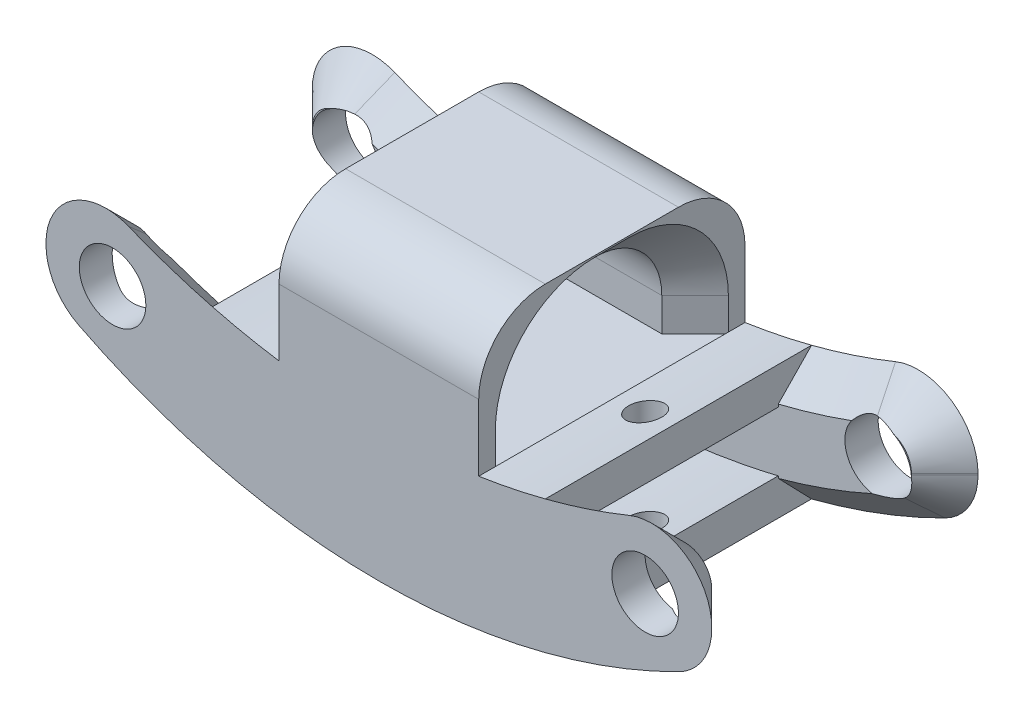
from build123d import *

# Parameters (mm, degrees)
SKETCH2_W               = 50
SKETCH2_H               = 10
BOSS_EXTRUDE2_DEPTH     = 10
CUT_EXTRUDE1_DEPTH      = 30
BOSS_EXTRUDE3_DEPTH     = 20
CUT_SWEEP1_START        = -7.5
CUT_SWEEP1_DEPTH        = 15
CUT_EXTRUDE3_DEPTH      = 30.35745708
CUT_EXTRUDE3_DEPTH_BACK = 30.35745708
SKETCH9_W               = 12.5
SKETCH9_H               = 15
CUT_EXTRUDE4_DEPTH      = 35.086071704
CUT_EXTRUDE4_DEPTH_BACK = 35.086071704
SKETCH10_R              = 2.5
FILLET1_R               = 4.5
BOSS_EXTRUDE4_DEPTH     = 20
SKETCH12_W              = 15
SKETCH12_H              = 20
BOSS_EXTRUDE5_DEPTH     = 10
SKETCH13_W              = 12.5
SKETCH13_H              = 7.5
CUT_EXTRUDE5_DEPTH      = 15
FILLET2_R               = 5
CHAMFER4_SIZE           = 2.5
CHAMFER5_SIZE           = 2.5
SKETCH14_R              = 1.25
CUT_EXTRUDE6_DEPTH      = 30.35745708


# Read off the part's stored shape, not the designer's step: Cut-Sweep1
with BuildPart() as part:
    # Sketch2 → Boss-Extrude2 (new, symmetric)
    with BuildSketch(Plane.XY):
        Rectangle(SKETCH2_W, SKETCH2_H)
    extrude(amount=BOSS_EXTRUDE2_DEPTH, both=True)

    # Sketch4 → Cut-Extrude1 (cut)
    with BuildSketch(Plane.XY.offset(10)):
        with BuildLine():
            ThreePointArc((-25, 5), (0, -1.698729811), (25, 5))
            Line((25, 5), (-25, 5))
        make_face()
        with BuildLine():
            ThreePointArc((-20.917760076, 2.887094942), (-22.701682649, 4.440465894), (-25, 5))
            ThreePointArc((-25, 5), (-22.983173509, 3.896611251), (-20.917760076, 2.887094942))
        make_face()
        with BuildLine():
            ThreePointArc((20.917760076, 2.887094942), (22.983173509, 3.896611251), (25, 5))
            ThreePointArc((25, 5), (22.701682649, 4.440465894), (20.917760076, 2.887094942))
        make_face()
    extrude(amount=-CUT_EXTRUDE1_DEPTH, mode=Mode.SUBTRACT)

    # Sketch5 → Boss-Extrude3 (add)
    with BuildSketch(Plane.XY.offset(10)):
        with BuildLine():
            Line((-25, -5), (25, -5))
            ThreePointArc((25, -5), (0, -11.698729811), (-25, -5))
        make_face()
    extrude(amount=-BOSS_EXTRUDE3_DEPTH)

    # Cut-Sweep1 outline → Cut-Sweep1 (cut)
    with BuildSketch(Plane.XY.offset(CUT_SWEEP1_START)):
        with BuildLine():
            add(Edge.make_bspline(
                [(-25, 2.5), (-21.255268345, 0.201017062), (-17.071138999, -1.630822115), (-8.283244372, -4.049516959), (-3.658771416, -4.626672198), (5.489489761, -4.455807498), (10.02627077, -3.697584153), (16.396780129, -1.708708768), (18.457451053, -0.894221408), (21.996641603, 0.764864463), (23.51747082, 1.610795597), (25, 2.511750463)],
                knots=[0.022827862, 0.022827862, 0.022827862, 0.022827862, 0.267120896, 0.267120896, 0.511413931, 0.511413931, 0.755706965, 0.755706965, 0.877853483, 0.877853483, 0.97657148, 0.97657148, 0.97657148, 0.97657148], degree=3))
            Line((-25, 2.5), (-25.000057187, -2.499968839))
            add(Edge.make_bspline(
                [(-25.000057187, -2.499968839), (-25.000038125, -2.499979226), (-25.000019062, -2.499989613), (-20.780823633, -4.798983078), (-16.147021573, -6.56849847), (-6.428489716, -8.717977703), (-1.37520543, -9.101253459), (8.592599128, -8.406410428), (13.482086252, -7.341506001), (20.316419226, -4.821848118), (22.503670345, -3.841925841), (24.731352369, -2.645524362), (24.865952164, -2.572392372), (25.000024678, -2.498748447)],
                knots=[0.022826758, 0.022826758, 0.022826758, 0.022826758, 0.022827862, 0.022827862, 0.267120896, 0.267120896, 0.511413931, 0.511413931, 0.755706965, 0.755706965, 0.877853483, 0.877853483, 0.885741168, 0.885741168, 0.885741168, 0.885741168], degree=3))
            Line((25.000024678, -2.498748447), (25, 2.511750463))
        make_face()
    extrude(amount=CUT_SWEEP1_DEPTH, mode=Mode.SUBTRACT)

    # Sketch9 → Cut-Extrude3 (cut, two sides: drawn at the far end of the back side and taken through both)
    with BuildSketch(Plane(origin=(0, 0, 0), x_dir=(1, 0, 0), z_dir=(0, 1, 0)).offset(-CUT_EXTRUDE3_DEPTH_BACK)):
        with Locations((18.75, 0)):
            Rectangle(SKETCH9_W, SKETCH9_H)
        with Locations((-18.75, 0)):
            Rectangle(SKETCH9_W, SKETCH9_H)
    extrude(amount=CUT_EXTRUDE3_DEPTH + CUT_EXTRUDE3_DEPTH_BACK, mode=Mode.SUBTRACT)

    # Sketch10 → Cut-Extrude4 (cut, two sides: drawn at the far end of the back side and taken through both)
    with BuildSketch(Plane.XY.offset(10).offset(-CUT_EXTRUDE4_DEPTH_BACK)):
        with Locations((-20, -2.52448676)):
            Circle(SKETCH10_R)
        with Locations(Location((20, -2.52448676, 0), (0, 0, 90))):
            Circle(SKETCH10_R)
    extrude(amount=CUT_EXTRUDE4_DEPTH + CUT_EXTRUDE4_DEPTH_BACK, mode=Mode.SUBTRACT)

    # Fillet1
    fillet1_edges = [part.edges().sort_by_distance(p)[0] for p in [
        (25, -5, -8.75),
        (25, 5, -8.75),
        (25, -5, 8.75),
        (25, 5, 8.75),
        (-25, -5, 8.75),
        (-25, 5, 8.75),
        (-25, -5, -8.75),
        (-25, 5, -8.75),
    ]]
    fillet(fillet1_edges, radius=FILLET1_R)

    # Sketch11 → Boss-Extrude4 (add)
    with BuildSketch(Plane.XY.offset(10)):
        with BuildLine():
            Line((-7.5, -1.133029644), (7.5, -1.133029644))
            ThreePointArc((7.5, -1.133029644), (0, -1.698729811), (-7.5, -1.133029644))
        make_face()
    extrude(amount=-BOSS_EXTRUDE4_DEPTH)

    # Sketch12 → Boss-Extrude5 (add)
    with BuildSketch(Plane(origin=(0, -1.133029644, 0), x_dir=(1, 0, 0), z_dir=(0, 1, 0))):
        Rectangle(SKETCH12_W, SKETCH12_H)
    extrude(amount=BOSS_EXTRUDE5_DEPTH)

    # Sketch13 → Cut-Extrude5 (cut)
    with BuildSketch(Plane.ZY.offset(7.5)):
        with Locations((0, 2.5)):
            Rectangle(SKETCH13_W, SKETCH13_H)
    extrude(amount=-CUT_EXTRUDE5_DEPTH, mode=Mode.SUBTRACT)

    # Fillet2
    fillet2_edges = [part.edges().sort_by_distance(p)[0] for p in [
        (0, 8.866970356, -10),
        (0, 8.866970356, 10),
        (0, 6.25, 6.25),
        (0, 6.25, -6.25),
    ]]
    fillet(fillet2_edges, radius=FILLET2_R)

    # Chamfer4
    # the kernel refuses this chamfer: 2.5 mm, written as the material it takes off along each edge
    with BuildSketch(Plane(origin=(0, 48.301270189, -7.5), x_dir=(0.12377747370188183, -0.9923100004554928, 0), z_dir=(-0.9923100004554928, -0.12377747370188183, 0))) as chamfer4_piece_1_section:
        Polygon((50, -CHAMFER4_SIZE), (50 + CHAMFER4_SIZE, 0), (50, 0), align=None)
    chamfer4_piece_1 = revolve(axis=Axis((0, 48.301270189, -7.5), (0, 0, 1)), revolution_arc=14.985047226, mode=Mode.PRIVATE)
    chamfer4_piece_1 = split(chamfer4_piece_1, bisect_by=Plane(origin=(12.5, 0.026116654, -8.312586528), z_dir=(1, 0, 0)), keep=Keep.TOP, mode=Mode.PRIVATE)
    add(chamfer4_piece_1, mode=Mode.SUBTRACT)
    with BuildSketch(Plane(origin=(20.5, -2.196254503, -7.5), x_dir=(-0.3761467889908264, 0.9265600860882637, 0), z_dir=(-0.9265600860882637, -0.3761467889908264, 0))) as chamfer4_piece_2:
        Polygon((4.5, CHAMFER4_SIZE), (4.5 - CHAMFER4_SIZE, 0), (4.5, 0), align=None)
    revolve(axis=Axis((20.5, -2.196254503, -7.5), (0, 0, -1)), revolution_arc=112.095209143, mode=Mode.SUBTRACT)
    with BuildSketch(Plane(origin=(0, 38.301270189, -7.5), x_dir=(0.12377688349554117, -0.992310074075705, 0), z_dir=(-0.992310074075705, -0.12377688349554117, 0))) as chamfer4_piece_3_section:
        Polygon((50, -CHAMFER4_SIZE), (50 - CHAMFER4_SIZE, 0), (50, 0), align=None)
    chamfer4_piece_3 = revolve(axis=Axis((0, 38.301270189, -7.5), (0, 0, 1)), revolution_arc=19.668813754, mode=Mode.PRIVATE)
    chamfer4_piece_3 = split(chamfer4_piece_3, bisect_by=Plane(origin=(12.5, -7.616649205, -8.334190852), z_dir=(1, 0, 0)), keep=Keep.TOP, mode=Mode.PRIVATE)
    add(chamfer4_piece_3, mode=Mode.SUBTRACT)
    with BuildSketch(Plane(origin=(25, -2.196254503, -7.5), x_dir=(0.027495876610586317, 0, -0.9996219169112968), z_dir=(0, -1, 0)), Plane(origin=(25, -2.196254503, 7.5), x_dir=(-0.9996219169112968, 0, -0.027495876610586317), z_dir=(0, -1, 0)), Plane(origin=(-25, -2.318921834, -7.5), x_dir=(-0.02749587661058908, 0, -0.9996219169112968), z_dir=(0, 1, 0)), Plane(origin=(-25, -2.318921834, 7.5), x_dir=(0.9996219169112968, 0, -0.027495876610586317), z_dir=(0, 1, 0))) as chamfer4_piece_4:
        Polygon((CHAMFER4_SIZE * 0.999621916911, -CHAMFER4_SIZE * 0.0274958766106), (-CHAMFER4_SIZE * 0.0274958766106, -CHAMFER4_SIZE * 0.999621916911), (0, 0), align=None)
    extrude(amount=0.122667331, mode=Mode.SUBTRACT)
    with BuildSketch(Plane(origin=(20.5, -2.318921834, -7.5), x_dir=(0.45054945054944934, -0.8927514730369194, 0), z_dir=(-0.8927514730369194, -0.45054945054944934, 0))) as chamfer4_piece_5:
        Polygon((4.5, -CHAMFER4_SIZE), (4.5 - CHAMFER4_SIZE, 0), (4.5, 0), align=None)
    revolve(axis=Axis((20.5, -2.318921834, -7.5), (0, 0, 1)), revolution_arc=63.221058408, mode=Mode.SUBTRACT)
    with BuildSketch(Plane(origin=(0, 48.301270189, 7.5), x_dir=(0.12377747370188183, -0.9923100004554928, 0), z_dir=(-0.9923100004554928, -0.12377747370188183, 0))) as chamfer4_piece_6_section:
        Polygon((50, CHAMFER4_SIZE), (50 + CHAMFER4_SIZE, 0), (50, 0), align=None)
    chamfer4_piece_6 = revolve(axis=Axis((0, 48.301270189, 7.5), (0, 0, 1)), revolution_arc=14.985047226, mode=Mode.PRIVATE)
    chamfer4_piece_6 = split(chamfer4_piece_6, bisect_by=Plane(origin=(12.5, 0.026116654, 8.312586528), z_dir=(1, 0, 0)), keep=Keep.TOP, mode=Mode.PRIVATE)
    add(chamfer4_piece_6, mode=Mode.SUBTRACT)
    with BuildSketch(Plane(origin=(20.5, -2.196254503, 7.5), x_dir=(-0.3761467889908264, 0.9265600860882637, 0), z_dir=(-0.9265600860882637, -0.3761467889908264, 0))) as chamfer4_piece_7:
        Polygon((4.5, -CHAMFER4_SIZE), (4.5 - CHAMFER4_SIZE, 0), (4.5, 0), align=None)
    revolve(axis=Axis((20.5, -2.196254503, 7.5), (0, 0, -1)), revolution_arc=112.095209143, mode=Mode.SUBTRACT)
    with BuildSketch(Plane(origin=(0, 38.301270189, 7.5), x_dir=(0.12377688349554117, -0.992310074075705, 0), z_dir=(-0.992310074075705, -0.12377688349554117, 0))) as chamfer4_piece_8_section:
        Polygon((50, CHAMFER4_SIZE), (50 - CHAMFER4_SIZE, 0), (50, 0), align=None)
    chamfer4_piece_8 = revolve(axis=Axis((0, 38.301270189, 7.5), (0, 0, 1)), revolution_arc=19.668813754, mode=Mode.PRIVATE)
    chamfer4_piece_8 = split(chamfer4_piece_8, bisect_by=Plane(origin=(12.5, -7.616649205, 8.334190852), z_dir=(1, 0, 0)), keep=Keep.TOP, mode=Mode.PRIVATE)
    add(chamfer4_piece_8, mode=Mode.SUBTRACT)
    with BuildSketch(Plane(origin=(20.5, -2.318921834, 7.5), x_dir=(0.45054945054944934, -0.8927514730369194, 0), z_dir=(-0.8927514730369194, -0.45054945054944934, 0))) as chamfer4_piece_9:
        Polygon((4.5 - CHAMFER4_SIZE, 0), (4.5, CHAMFER4_SIZE), (4.5, 0), align=None)
    revolve(axis=Axis((20.5, -2.318921834, 7.5), (0, 0, 1)), revolution_arc=63.221058408, mode=Mode.SUBTRACT)
    with BuildSketch(Plane(origin=(0, 48.301270189, -7.5), x_dir=(-0.37614678899082576, -0.926560086088264, 0), z_dir=(-0.926560086088264, 0.37614678899082576, 0))) as chamfer4_piece_10_section:
        Polygon((50, -CHAMFER4_SIZE), (50 + CHAMFER4_SIZE, 0), (50, 0), align=None)
    chamfer4_piece_10 = revolve(axis=Axis((0, 48.301270189, -7.5), (0, 0, 1)), revolution_arc=14.985047226, mode=Mode.PRIVATE)
    chamfer4_piece_10 = split(chamfer4_piece_10, bisect_by=Plane(origin=(-12.5, 0.026116654, -8.312586528), z_dir=(-1, 0, 0)), keep=Keep.TOP, mode=Mode.PRIVATE)
    add(chamfer4_piece_10, mode=Mode.SUBTRACT)
    with BuildSketch(Plane(origin=(-20.5, -2.196254503, -7.5), x_dir=(-1, 0, 0), z_dir=(0, -1, 0))) as chamfer4_piece_11:
        Polygon((4.5, CHAMFER4_SIZE), (4.5 - CHAMFER4_SIZE, 0), (4.5, 0), align=None)
    revolve(axis=Axis((-20.5, -2.196254503, -7.5), (0, 0, -1)), revolution_arc=112.095209143, mode=Mode.SUBTRACT)
    with BuildSketch(Plane(origin=(0, 38.301270189, -7.5), x_dir=(-0.45054945054945034, -0.8927514730369189, 0), z_dir=(-0.8927514730369189, 0.45054945054945034, 0))) as chamfer4_piece_12_section:
        Polygon((50, -CHAMFER4_SIZE), (50 - CHAMFER4_SIZE, 0), (50, 0), align=None)
    chamfer4_piece_12 = revolve(axis=Axis((0, 38.301270189, -7.5), (0, 0, 1)), revolution_arc=19.668813754, mode=Mode.PRIVATE)
    chamfer4_piece_12 = split(chamfer4_piece_12, bisect_by=Plane(origin=(-12.5, -7.616649205, -8.334190852), z_dir=(-1, 0, 0)), keep=Keep.TOP, mode=Mode.PRIVATE)
    add(chamfer4_piece_12, mode=Mode.SUBTRACT)
    with BuildSketch(Plane(origin=(-20.5, -2.318921834, -7.5), x_dir=(-1, 0, 0), z_dir=(0, 1, 0))) as chamfer4_piece_13:
        Polygon((4.5, -CHAMFER4_SIZE), (4.5 - CHAMFER4_SIZE, 0), (4.5, 0), align=None)
    revolve(axis=Axis((-20.5, -2.318921834, -7.5), (0, 0, 1)), revolution_arc=63.221058408, mode=Mode.SUBTRACT)
    with BuildSketch(Plane(origin=(0, 48.301270189, 7.5), x_dir=(-0.37614678899082576, -0.926560086088264, 0), z_dir=(-0.926560086088264, 0.37614678899082576, 0))) as chamfer4_piece_14_section:
        Polygon((50, CHAMFER4_SIZE), (50 + CHAMFER4_SIZE, 0), (50, 0), align=None)
    chamfer4_piece_14 = revolve(axis=Axis((0, 48.301270189, 7.5), (0, 0, 1)), revolution_arc=14.985047226, mode=Mode.PRIVATE)
    chamfer4_piece_14 = split(chamfer4_piece_14, bisect_by=Plane(origin=(-12.5, 0.026116654, 8.312586528), z_dir=(-1, 0, 0)), keep=Keep.TOP, mode=Mode.PRIVATE)
    add(chamfer4_piece_14, mode=Mode.SUBTRACT)
    with BuildSketch(Plane(origin=(-20.5, -2.196254503, 7.5), x_dir=(0.37614678899082477, 0.9265600860882643, 0), z_dir=(0.9265600860882643, -0.37614678899082477, 0))) as chamfer4_piece_15:
        Polygon((4.5 - CHAMFER4_SIZE, 0), (4.5, CHAMFER4_SIZE), (4.5, 0), align=None)
    revolve(axis=Axis((-20.5, -2.196254503, 7.5), (0, 0, 1)), revolution_arc=112.095209143, mode=Mode.SUBTRACT)
    with BuildSketch(Plane(origin=(0, 38.301270189, 7.5), x_dir=(-0.45054945054945034, -0.8927514730369189, 0), z_dir=(-0.8927514730369189, 0.45054945054945034, 0))) as chamfer4_piece_16_section:
        Polygon((50, CHAMFER4_SIZE), (50 - CHAMFER4_SIZE, 0), (50, 0), align=None)
    chamfer4_piece_16 = revolve(axis=Axis((0, 38.301270189, 7.5), (0, 0, 1)), revolution_arc=19.668813754, mode=Mode.PRIVATE)
    chamfer4_piece_16 = split(chamfer4_piece_16, bisect_by=Plane(origin=(-12.5, -7.616649205, 8.334190852), z_dir=(-1, 0, 0)), keep=Keep.TOP, mode=Mode.PRIVATE)
    add(chamfer4_piece_16, mode=Mode.SUBTRACT)
    with BuildSketch(Plane(origin=(-20.5, -2.318921834, 7.5), x_dir=(-0.45054945054944695, -0.8927514730369206, 0), z_dir=(0.8927514730369206, -0.45054945054944695, 0))) as chamfer4_piece_17:
        Polygon((4.5 - CHAMFER4_SIZE, 0), (4.5, -CHAMFER4_SIZE), (4.5, 0), align=None)
    revolve(axis=Axis((-20.5, -2.318921834, 7.5), (0, 0, -1)), revolution_arc=63.221058408, mode=Mode.SUBTRACT)

    # Chamfer5
    # the kernel refuses this chamfer: 2.5 mm, written as the material it takes off along each edge
    with BuildSketch(Plane(origin=(7.5, -7.562237114, 6.25), x_dir=(0.027495876610586317, 0, 0.9996219169112968), z_dir=(0, 1, 0))) as chamfer5_piece_1_section:
        Polygon((CHAMFER5_SIZE * 0.999621916911, -CHAMFER5_SIZE * 0.0274958766106), (-CHAMFER5_SIZE * 0.0274958766106, -CHAMFER5_SIZE * 0.999621916911), (0, 0), align=None)
    chamfer5_piece_1 = extrude(amount=8.812237114, mode=Mode.PRIVATE)
    chamfer5_piece_1 = split(chamfer5_piece_1, bisect_by=Plane(origin=(7.268053579, -1.25, 8.009026789), z_dir=(0, 1, 0)), keep=Keep.TOP, mode=Mode.PRIVATE)
    add(chamfer5_piece_1, mode=Mode.SUBTRACT)
    with BuildSketch(Plane(origin=(7.5, 1.25, -6.25), x_dir=(0.027495876610611186, 0, -0.999621916911296), z_dir=(0, -1, 0))) as chamfer5_piece_2_section:
        Polygon((CHAMFER5_SIZE * 0.999621916911, -CHAMFER5_SIZE * 0.0274958766106), (-CHAMFER5_SIZE * 0.0274958766106, -CHAMFER5_SIZE * 0.999621916911), (0, 0), align=None)
    chamfer5_piece_2 = extrude(amount=8.812237114, mode=Mode.PRIVATE)
    chamfer5_piece_2 = split(chamfer5_piece_2, bisect_by=Plane(origin=(7.078887777, -1.25, -7.914443888), z_dir=(0, 1, 0)), keep=Keep.TOP, mode=Mode.PRIVATE)
    add(chamfer5_piece_2, mode=Mode.SUBTRACT)
    with BuildSketch(Plane(origin=(7.5, 1.25, 1.25), x_dir=(0, 0, 1), z_dir=(0, -1, 0))) as chamfer5_piece_3:
        Polygon((5 + CHAMFER5_SIZE, 0), (5, CHAMFER5_SIZE), (5, 0), align=None)
    revolve(axis=Axis((7.5, 1.25, 1.25), (-1, 0, 0)), revolution_arc=90, mode=Mode.SUBTRACT)
    with BuildSketch(Plane(origin=(7.5, 1.25, -1.25), x_dir=(0, 1, 0), z_dir=(0, 0, 1))) as chamfer5_piece_4:
        Polygon((5 + CHAMFER5_SIZE, 0), (5, CHAMFER5_SIZE), (5, 0), align=None)
    revolve(axis=Axis((7.5, 1.25, -1.25), (-1, 0, 0)), revolution_arc=90, mode=Mode.SUBTRACT)
    with BuildSketch(Plane(origin=(7.5, 6.25, 1.25), x_dir=(0.02749587661063949, 0.9996219169112952, 0), z_dir=(0, 0, -1))) as chamfer5_piece_5:
        Polygon((CHAMFER5_SIZE * 0.999621916911, -CHAMFER5_SIZE * 0.0274958766106), (-CHAMFER5_SIZE * 0.0274958766106, -CHAMFER5_SIZE * 0.999621916911), (0, 0), align=None)
    extrude(amount=2.5, mode=Mode.SUBTRACT)
    with BuildSketch(Plane(origin=(-7.5, -7.562237114, 6.25), x_dir=(-0.027495876610586317, 0, 0.9996219169112968), z_dir=(0, 1, 0))) as chamfer5_piece_6_section:
        Polygon((CHAMFER5_SIZE * 0.999621916911, CHAMFER5_SIZE * 0.0274958766106), (-CHAMFER5_SIZE * 0.0274958766106, CHAMFER5_SIZE * 0.999621916911), (0, 0), align=None)
    chamfer5_piece_6 = extrude(amount=8.812237114, mode=Mode.PRIVATE)
    chamfer5_piece_6 = split(chamfer5_piece_6, bisect_by=Plane(origin=(-7.268053579, -1.25, 8.009026789), z_dir=(0, 1, 0)), keep=Keep.TOP, mode=Mode.PRIVATE)
    add(chamfer5_piece_6, mode=Mode.SUBTRACT)
    with BuildSketch(Plane(origin=(-7.5, 1.25, 1.25), x_dir=(0, 0, 1), z_dir=(0, -1, 0))) as chamfer5_piece_7:
        Polygon((5 + CHAMFER5_SIZE, 0), (5, -CHAMFER5_SIZE), (5, 0), align=None)
    revolve(axis=Axis((-7.5, 1.25, 1.25), (-1, 0, 0)), revolution_arc=90, mode=Mode.SUBTRACT)
    with BuildSketch(Plane(origin=(-7.5, 1.25, -6.25), x_dir=(-0.027495876610586664, 0, -0.9996219169112968), z_dir=(0, -1, 0))) as chamfer5_piece_8_section:
        Polygon((CHAMFER5_SIZE * 0.999621916911, CHAMFER5_SIZE * 0.0274958766106), (-CHAMFER5_SIZE * 0.0274958766106, CHAMFER5_SIZE * 0.999621916911), (0, 0), align=None)
    chamfer5_piece_8 = extrude(amount=8.812237114, mode=Mode.PRIVATE)
    chamfer5_piece_8 = split(chamfer5_piece_8, bisect_by=Plane(origin=(-7.078887777, -1.25, -7.914443888), z_dir=(0, 1, 0)), keep=Keep.TOP, mode=Mode.PRIVATE)
    add(chamfer5_piece_8, mode=Mode.SUBTRACT)
    with BuildSketch(Plane(origin=(-7.5, 6.25, 1.25), x_dir=(-0.027495876610558353, 0.9996219169112974, 0), z_dir=(0, 0, -1))) as chamfer5_piece_9:
        Polygon((CHAMFER5_SIZE * 0.999621916911, CHAMFER5_SIZE * 0.0274958766106), (-CHAMFER5_SIZE * 0.0274958766106, CHAMFER5_SIZE * 0.999621916911), (0, 0), align=None)
    extrude(amount=2.5, mode=Mode.SUBTRACT)
    with BuildSketch(Plane(origin=(-7.5, 1.25, -1.25), x_dir=(0, 1, 0), z_dir=(0, 0, 1))) as chamfer5_piece_10:
        Polygon((5 + CHAMFER5_SIZE, 0), (5, -CHAMFER5_SIZE), (5, 0), align=None)
    revolve(axis=Axis((-7.5, 1.25, -1.25), (-1, 0, 0)), revolution_arc=90, mode=Mode.SUBTRACT)

    # Sketch14 → Cut-Extrude6 (cut, through all)
    with BuildSketch(Plane(origin=(0, 0, 0), x_dir=(1, 0, 0), z_dir=(0, 1, 0))):
        with Locations(Location((-10, 0, 0), (0, 0, 270))):
            Circle(SKETCH14_R)
        with Locations(Location((10, 0, 0), (0, 0, 270))):
            Circle(SKETCH14_R)
    extrude(amount=-CUT_EXTRUDE6_DEPTH, mode=Mode.SUBTRACT)


solid = part.part
